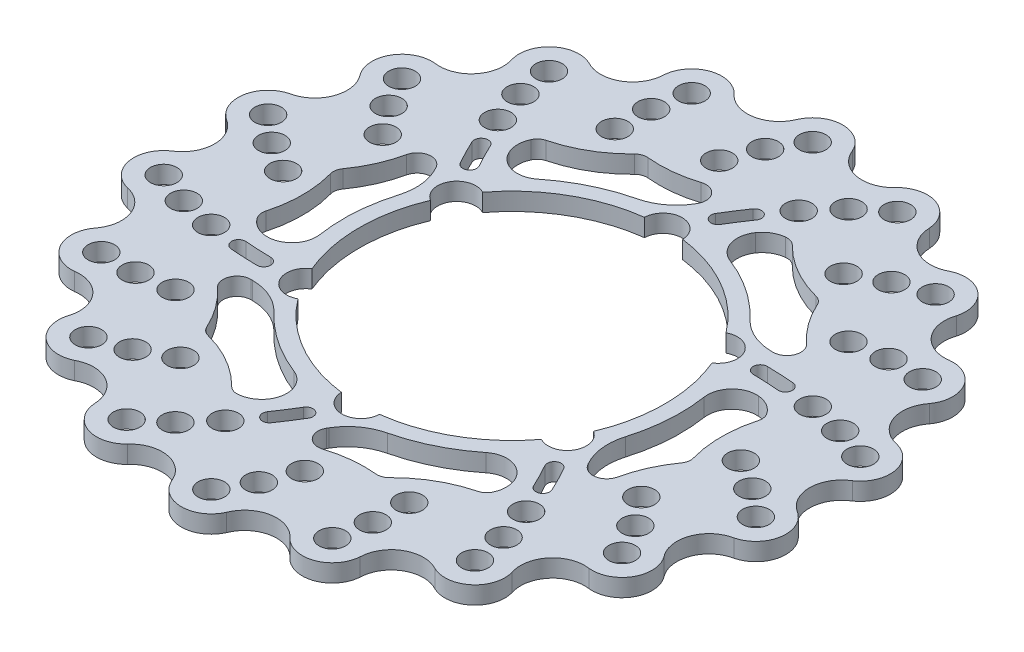
from build123d import *

# Parameters (mm, degrees)
SKETCH2_R           = 85.725
BOSS_EXTRUDE1_DEPTH = 5.08
CUT_EXTRUDE1_DEPTH  = 134.873116404
SKETCH4_R           = 3.81
CUT_EXTRUDE3_DEPTH  = 134.873116404
CUT_EXTRUDE4_DEPTH  = 10
CIRPATTERN1_DEPTH   = 5.08


# Read off the part's stored shape, not the designer's step: CirPattern1
with BuildPart() as part:
    # Sketch2 → Boss-Extrude1 (new body)
    with BuildSketch(Plane(origin=(0, 0, 0), x_dir=(1, 0, 0), z_dir=(0, 1, 0))):
        with BuildLine():
            ThreePointArc((-51.901497784, 74.123020608), (-56.734497332, 74.921995649), (-61.225519823, 72.965733207))
            ThreePointArc((-61.225519823, 72.965733207), (-63.931920113, 68.882640848), (-63.984324863, 63.984324863))
            ThreePointArc((-63.984324863, 63.984324863), (-58.164243832, 69.317446547), (-51.901497784, 74.123020608))
        make_face()
        with BuildLine():
            ThreePointArc((-51.901497784, 74.123020608), (-58.164243832, 69.317446547), (-63.984324863, 63.984324863))
            ThreePointArc((-63.984324863, 63.984324863), (-63.667616722, 59.323754786), (-65.669159886, 55.10296784))
            ThreePointArc((-65.669159886, 55.10296784), (-55.10296784, 65.669159886), (-42.8625, 74.240027739))
            ThreePointArc((-42.8625, 74.240027739), (-47.366728031, 73.001824475), (-51.901497784, 74.123020608))
        make_face()
        with BuildLine():
            ThreePointArc((-23.419888344, 87.404213206), (-27.688156797, 89.807987355), (-32.577418652, 89.50572213))
            ThreePointArc((-32.577418652, 89.50572213), (-36.517102868, 86.594513785), (-38.241669959, 82.009525879))
            ThreePointArc((-38.241669959, 82.009525879), (-30.948547719, 85.030436023), (-23.419888344, 87.404213206))
        make_face()
        with BuildLine():
            ThreePointArc((-23.419888344, 87.404213206), (-30.948547719, 85.030436023), (-38.241669959, 82.009525879))
            ThreePointArc((-38.241669959, 82.009525879), (-39.538070502, 77.521702006), (-42.8625, 74.240027739))
            ThreePointArc((-42.8625, 74.240027739), (-29.319676787, 80.555149917), (-14.88599003, 84.422644627))
            ThreePointArc((-14.88599003, 84.422644627), (-19.542070332, 84.799650873), (-23.419888344, 87.404213206))
        make_face()
        with BuildLine():
            ThreePointArc((14.88599003, 84.422644627), (10.63964946, 86.369387866), (7.886505272, 90.143167744))
            ThreePointArc((7.886505272, 90.143167744), (0, 90.4875), (-7.886505272, 90.143167744))
            ThreePointArc((-7.886505272, 90.143167744), (-10.63964946, 86.369387866), (-14.88599003, 84.422644627))
            ThreePointArc((-14.88599003, 84.422644627), (0, 85.725), (14.88599003, 84.422644627))
        make_face()
        with BuildLine():
            ThreePointArc((7.886505272, 90.143167744), (4.697784081, 93.861810361), (0, 95.25))
            ThreePointArc((0, 95.25), (-4.697784081, 93.861810361), (-7.886505272, 90.143167744))
            ThreePointArc((-7.886505272, 90.143167744), (0, 90.4875), (7.886505272, 90.143167744))
        make_face()
        with BuildLine():
            ThreePointArc((38.241669959, 82.009525879), (30.948547719, 85.030436023), (23.419888344, 87.404213206))
            ThreePointArc((23.419888344, 87.404213206), (19.542070332, 84.799650873), (14.88599003, 84.422644627))
            ThreePointArc((14.88599003, 84.422644627), (29.319676787, 80.555149917), (42.8625, 74.240027739))
            ThreePointArc((42.8625, 74.240027739), (39.538070502, 77.521702006), (38.241669959, 82.009525879))
        make_face()
        with BuildLine():
            ThreePointArc((38.241669959, 82.009525879), (36.517102868, 86.594513785), (32.577418652, 89.50572213))
            ThreePointArc((32.577418652, 89.50572213), (27.688156797, 89.807987355), (23.419888344, 87.404213206))
            ThreePointArc((23.419888344, 87.404213206), (30.948547719, 85.030436023), (38.241669959, 82.009525879))
        make_face()
        with BuildLine():
            ThreePointArc((63.984324863, 63.984324863), (63.931920113, 68.882640848), (61.225519823, 72.965733207))
            ThreePointArc((61.225519823, 72.965733207), (56.734497332, 74.921995649), (51.901497784, 74.123020608))
            ThreePointArc((51.901497784, 74.123020608), (58.164243832, 69.317446547), (63.984324863, 63.984324863))
        make_face()
        with BuildLine():
            ThreePointArc((63.984324863, 63.984324863), (58.164243832, 69.317446547), (51.901497784, 74.123020608))
            ThreePointArc((51.901497784, 74.123020608), (47.366728031, 73.001824475), (42.8625, 74.240027739))
            ThreePointArc((42.8625, 74.240027739), (55.10296784, 65.669159886), (65.669159886, 55.10296784))
            ThreePointArc((65.669159886, 55.10296784), (63.667616722, 59.323754786), (63.984324863, 63.984324863))
        make_face()
        with BuildLine():
            ThreePointArc((82.009525879, 38.241669959), (78.364473725, 45.24375), (74.123020608, 51.901497784))
            ThreePointArc((74.123020608, 51.901497784), (69.478259272, 52.398900653), (65.669159886, 55.10296784))
            ThreePointArc((65.669159886, 55.10296784), (74.240027739, 42.8625), (80.555149917, 29.319676787))
            ThreePointArc((80.555149917, 29.319676787), (80.117908731, 33.970487214), (82.009525879, 38.241669959))
        make_face()
        with BuildLine():
            ThreePointArc((82.009525879, 38.241669959), (83.635604259, 42.862504825), (82.48891971, 47.625))
            ThreePointArc((82.48891971, 47.625), (78.937820177, 50.999305536), (74.123020608, 51.901497784))
            ThreePointArc((74.123020608, 51.901497784), (78.364473725, 45.24375), (82.009525879, 38.241669959))
        make_face()
        with BuildLine():
            ThreePointArc((90.143167744, 7.886505272), (89.112791551, 15.712989477), (87.404213206, 23.419888344))
            ThreePointArc((87.404213206, 23.419888344), (83.209687054, 25.475896086), (80.555149917, 29.319676787))
            ThreePointArc((80.555149917, 29.319676787), (84.422644627, 14.88599003), (85.725, 0))
            ThreePointArc((85.725, 0), (86.904798533, 4.519877532), (90.143167744, 7.886505272))
        make_face()
        with BuildLine():
            ThreePointArc((90.143167744, 7.886505272), (93.2516002, 11.672518136), (93.802938474, 16.539988923))
            ThreePointArc((93.802938474, 16.539988923), (91.620076911, 20.925346507), (87.404213206, 23.419888344))
            ThreePointArc((87.404213206, 23.419888344), (89.112791551, 15.712989477), (90.143167744, 7.886505272))
        make_face()
        with BuildLine():
            ThreePointArc((87.404213206, -23.419888344), (89.112791551, -15.712989477), (90.143167744, -7.886505272))
            ThreePointArc((90.143167744, -7.886505272), (86.904798533, -4.519877532), (85.725, 0))
            ThreePointArc((85.725, 0), (84.422644627, -14.88599003), (80.555149917, -29.319676787))
            ThreePointArc((80.555149917, -29.319676787), (83.209687054, -25.475896086), (87.404213206, -23.419888344))
        make_face()
        with BuildLine():
            ThreePointArc((87.404213206, -23.419888344), (91.620076911, -20.925346507), (93.802938474, -16.539988923))
            ThreePointArc((93.802938474, -16.539988923), (93.2516002, -11.672518136), (90.143167744, -7.886505272))
            ThreePointArc((90.143167744, -7.886505272), (89.112791551, -15.712989477), (87.404213206, -23.419888344))
        make_face()
        with BuildLine():
            ThreePointArc((74.123020608, -51.901497784), (78.364473725, -45.24375), (82.009525879, -38.241669959))
            ThreePointArc((82.009525879, -38.241669959), (80.117908731, -33.970487214), (80.555149917, -29.319676787))
            ThreePointArc((80.555149917, -29.319676787), (74.240027739, -42.8625), (65.669159886, -55.10296784))
            ThreePointArc((65.669159886, -55.10296784), (69.478259272, -52.398900653), (74.123020608, -51.901497784))
        make_face()
        with BuildLine():
            ThreePointArc((74.123020608, -51.901497784), (78.937820177, -50.999305536), (82.48891971, -47.625))
            ThreePointArc((82.48891971, -47.625), (83.635604259, -42.862504825), (82.009525879, -38.241669959))
            ThreePointArc((82.009525879, -38.241669959), (78.364473725, -45.24375), (74.123020608, -51.901497784))
        make_face()
        with BuildLine():
            ThreePointArc((51.901497784, -74.123020608), (58.164243832, -69.317446547), (63.984324863, -63.984324863))
            ThreePointArc((63.984324863, -63.984324863), (63.667616722, -59.323754786), (65.669159886, -55.10296784))
            ThreePointArc((65.669159886, -55.10296784), (55.10296784, -65.669159886), (42.8625, -74.240027739))
            ThreePointArc((42.8625, -74.240027739), (47.366728031, -73.001824475), (51.901497784, -74.123020608))
        make_face()
        with BuildLine():
            ThreePointArc((51.901497784, -74.123020608), (56.734497332, -74.921995649), (61.225519823, -72.965733207))
            ThreePointArc((61.225519823, -72.965733207), (63.931920113, -68.882640848), (63.984324863, -63.984324863))
            ThreePointArc((63.984324863, -63.984324863), (58.164243832, -69.317446547), (51.901497784, -74.123020608))
        make_face()
        with BuildLine():
            ThreePointArc((23.419888344, -87.404213206), (30.948547719, -85.030436023), (38.241669959, -82.009525879))
            ThreePointArc((38.241669959, -82.009525879), (39.538070502, -77.521702006), (42.8625, -74.240027739))
            ThreePointArc((42.8625, -74.240027739), (29.319676787, -80.555149917), (14.88599003, -84.422644627))
            ThreePointArc((14.88599003, -84.422644627), (19.542070332, -84.799650873), (23.419888344, -87.404213206))
        make_face()
        with BuildLine():
            ThreePointArc((23.419888344, -87.404213206), (27.688156797, -89.807987355), (32.577418652, -89.50572213))
            ThreePointArc((32.577418652, -89.50572213), (36.517102868, -86.594513785), (38.241669959, -82.009525879))
            ThreePointArc((38.241669959, -82.009525879), (30.948547719, -85.030436023), (23.419888344, -87.404213206))
        make_face()
        with BuildLine():
            ThreePointArc((-7.886505272, -90.143167744), (0, -90.4875), (7.886505272, -90.143167744))
            ThreePointArc((7.886505272, -90.143167744), (10.63964946, -86.369387866), (14.88599003, -84.422644627))
            ThreePointArc((14.88599003, -84.422644627), (0, -85.725), (-14.88599003, -84.422644627))
            ThreePointArc((-14.88599003, -84.422644627), (-10.63964946, -86.369387866), (-7.886505272, -90.143167744))
        make_face()
        with BuildLine():
            ThreePointArc((-7.886505272, -90.143167744), (-4.697784081, -93.861810361), (0, -95.25))
            ThreePointArc((0, -95.25), (4.697784081, -93.861810361), (7.886505272, -90.143167744))
            ThreePointArc((7.886505272, -90.143167744), (0, -90.4875), (-7.886505272, -90.143167744))
        make_face()
        with BuildLine():
            ThreePointArc((-38.241669959, -82.009525879), (-30.948547719, -85.030436023), (-23.419888344, -87.404213206))
            ThreePointArc((-23.419888344, -87.404213206), (-19.542070332, -84.799650873), (-14.88599003, -84.422644627))
            ThreePointArc((-14.88599003, -84.422644627), (-29.319676787, -80.555149917), (-42.8625, -74.240027739))
            ThreePointArc((-42.8625, -74.240027739), (-39.538070502, -77.521702006), (-38.241669959, -82.009525879))
        make_face()
        with BuildLine():
            ThreePointArc((-38.241669959, -82.009525879), (-36.517102868, -86.594513785), (-32.577418652, -89.50572213))
            ThreePointArc((-32.577418652, -89.50572213), (-27.688156797, -89.807987355), (-23.419888344, -87.404213206))
            ThreePointArc((-23.419888344, -87.404213206), (-30.948547719, -85.030436023), (-38.241669959, -82.009525879))
        make_face()
        with BuildLine():
            ThreePointArc((-63.984324863, -63.984324863), (-58.164243832, -69.317446547), (-51.901497784, -74.123020608))
            ThreePointArc((-51.901497784, -74.123020608), (-47.366728031, -73.001824475), (-42.8625, -74.240027739))
            ThreePointArc((-42.8625, -74.240027739), (-55.10296784, -65.669159886), (-65.669159886, -55.10296784))
            ThreePointArc((-65.669159886, -55.10296784), (-63.667616722, -59.323754786), (-63.984324863, -63.984324863))
        make_face()
        with BuildLine():
            ThreePointArc((-63.984324863, -63.984324863), (-63.931920113, -68.882640848), (-61.225519823, -72.965733207))
            ThreePointArc((-61.225519823, -72.965733207), (-56.734497332, -74.921995649), (-51.901497784, -74.123020608))
            ThreePointArc((-51.901497784, -74.123020608), (-58.164243832, -69.317446547), (-63.984324863, -63.984324863))
        make_face()
        with BuildLine():
            ThreePointArc((-82.009525879, -38.241669959), (-78.364473725, -45.24375), (-74.123020608, -51.901497784))
            ThreePointArc((-74.123020608, -51.901497784), (-69.478259272, -52.398900653), (-65.669159886, -55.10296784))
            ThreePointArc((-65.669159886, -55.10296784), (-74.240027739, -42.8625), (-80.555149917, -29.319676787))
            ThreePointArc((-80.555149917, -29.319676787), (-80.117908731, -33.970487214), (-82.009525879, -38.241669959))
        make_face()
        with BuildLine():
            ThreePointArc((-82.009525879, -38.241669959), (-83.635604259, -42.862504825), (-82.48891971, -47.625))
            ThreePointArc((-82.48891971, -47.625), (-78.937820177, -50.999305536), (-74.123020608, -51.901497784))
            ThreePointArc((-74.123020608, -51.901497784), (-78.364473725, -45.24375), (-82.009525879, -38.241669959))
        make_face()
        Circle(SKETCH2_R)
        with BuildLine():
            ThreePointArc((-90.143167744, -7.886505272), (-93.2516002, -11.672518136), (-93.802938474, -16.539988923))
            ThreePointArc((-93.802938474, -16.539988923), (-91.620076911, -20.925346507), (-87.404213206, -23.419888344))
            ThreePointArc((-87.404213206, -23.419888344), (-89.112791551, -15.712989477), (-90.143167744, -7.886505272))
        make_face()
        with BuildLine():
            ThreePointArc((-87.404213206, 23.419888344), (-91.620076911, 20.925346507), (-93.802938474, 16.539988923))
            ThreePointArc((-93.802938474, 16.539988923), (-93.2516002, 11.672518136), (-90.143167744, 7.886505272))
            ThreePointArc((-90.143167744, 7.886505272), (-89.112791551, 15.712989477), (-87.404213206, 23.419888344))
        make_face()
        with BuildLine():
            ThreePointArc((-74.123020608, 51.901497784), (-78.937820177, 50.999305536), (-82.48891971, 47.625))
            ThreePointArc((-82.48891971, 47.625), (-83.635604259, 42.862504825), (-82.009525879, 38.241669959))
            ThreePointArc((-82.009525879, 38.241669959), (-78.364473725, 45.24375), (-74.123020608, 51.901497784))
        make_face()
        with BuildLine():
            ThreePointArc((-74.123020608, 51.901497784), (-78.364473725, 45.24375), (-82.009525879, 38.241669959))
            ThreePointArc((-82.009525879, 38.241669959), (-80.117908731, 33.970487214), (-80.555149917, 29.319676787))
            ThreePointArc((-80.555149917, 29.319676787), (-74.240027739, 42.8625), (-65.669159886, 55.10296784))
            ThreePointArc((-65.669159886, 55.10296784), (-69.478259272, 52.398900653), (-74.123020608, 51.901497784))
        make_face()
        with BuildLine():
            ThreePointArc((-87.404213206, 23.419888344), (-89.112791551, 15.712989477), (-90.143167744, 7.886505272))
            ThreePointArc((-90.143167744, 7.886505272), (-86.904798533, 4.519877532), (-85.725, 0))
            ThreePointArc((-85.725, 0), (-84.422644627, 14.88599003), (-80.555149917, 29.319676787))
            ThreePointArc((-80.555149917, 29.319676787), (-83.209687054, 25.475896086), (-87.404213206, 23.419888344))
        make_face()
        with BuildLine():
            ThreePointArc((-90.143167744, -7.886505272), (-89.112791551, -15.712989477), (-87.404213206, -23.419888344))
            ThreePointArc((-87.404213206, -23.419888344), (-83.209687054, -25.475896086), (-80.555149917, -29.319676787))
            ThreePointArc((-80.555149917, -29.319676787), (-84.422644627, -14.88599003), (-85.725, 0))
            ThreePointArc((-85.725, 0), (-86.904798533, -4.519877532), (-90.143167744, -7.886505272))
        make_face()
    extrude(amount=BOSS_EXTRUDE1_DEPTH)

    # Sketch3 → Cut-Extrude1 (cut, through all)
    with BuildSketch(Plane(origin=(0, 5.08, 0), x_dir=(1, 0, 0), z_dir=(0, 1, 0))):
        with BuildLine():
            ThreePointArc((-5.497810612, -43.655172414), (0, -49), (5.497810612, -43.655172414))
            ThreePointArc((5.497810612, -43.655172414), (22, -38.105117767), (35.057583011, -26.588829862))
            ThreePointArc((35.057583011, -26.588829862), (42.435244785, -24.5), (40.555393623, -17.066342552))
            ThreePointArc((40.555393623, -17.066342552), (44, 0), (40.555393623, 17.066342552))
            ThreePointArc((40.555393623, 17.066342552), (42.435244785, 24.5), (35.057583011, 26.588829862))
            ThreePointArc((35.057583011, 26.588829862), (22, 38.105117767), (5.497810612, 43.655172414))
            ThreePointArc((5.497810612, 43.655172414), (0, 49), (-5.497810612, 43.655172414))
            ThreePointArc((-5.497810612, 43.655172414), (-22, 38.105117767), (-35.057583011, 26.588829862))
            ThreePointArc((-35.057583011, 26.588829862), (-42.435244785, 24.5), (-40.555393623, 17.066342552))
            ThreePointArc((-40.555393623, 17.066342552), (-44, 0), (-40.555393623, -17.066342552))
            ThreePointArc((-40.555393623, -17.066342552), (-42.435244785, -24.5), (-35.057583011, -26.588829862))
            ThreePointArc((-35.057583011, -26.588829862), (-22, -38.105117767), (-5.497810612, -43.655172414))
        make_face()
    extrude(amount=-CUT_EXTRUDE1_DEPTH, mode=Mode.SUBTRACT)

    # Sketch4 → Cut-Extrude3 (cut, through all)
    with BuildSketch(Plane(origin=(0, 5.08, 0), x_dir=(1, 0, 0), z_dir=(0, 1, 0))):
        with Locations(Location((37.27116983, 58.247639646, 0), (0, 0, 270))):
            Circle(SKETCH4_R)
        with Locations(Location((46.242768954, 63.054604001, 0), (0, 0, 270))):
            Circle(SKETCH4_R)
        with Locations(Location((55.669906593, 66.344811182, 0), (0, 0, 270))):
            Circle(SKETCH4_R)
        with Locations(Location((75.003862255, 43.303500063, 0), (0, 0, 270))):
            Circle(SKETCH4_R)
        with Locations(Location((65.019933448, 43.435987621, 0), (0, 0, 270))):
            Circle(SKETCH4_R)
        with Locations(Location((54.945309318, 41.987386307, 0), (0, 0, 270))):
            Circle(SKETCH4_R)
        with Locations(Location((85.291245189, 15.039147745, 0), (0, 0, 270))):
            Circle(SKETCH4_R)
        with Locations(Location((75.954734377, 18.578350087, 0), (0, 0, 270))):
            Circle(SKETCH4_R)
        with Locations(Location((65.992233595, 20.662834511, 0), (0, 0, 270))):
            Circle(SKETCH4_R)
        with Locations(Location((85.291245189, -15.039147745, 0), (0, 0, 270))):
            Circle(SKETCH4_R)
        with Locations(Location((77.728273367, -8.520110655, 0), (0, 0, 270))):
            Circle(SKETCH4_R)
        with Locations(Location((69.079520559, -3.153960078, 0), (0, 0, 270))):
            Circle(SKETCH4_R)
        with Locations(Location((75.003862255, -43.303500063, 0), (0, 0, 270))):
            Circle(SKETCH4_R)
        with Locations(Location((70.126635442, -34.590920308, 0), (0, 0, 270))):
            Circle(SKETCH4_R)
        with Locations(Location((63.834797839, -26.590340534, 0), (0, 0, 270))):
            Circle(SKETCH4_R)
        with Locations(Location((55.669906593, -66.344811182, 0), (0, 0, 270))):
            Circle(SKETCH4_R)
        with Locations(Location((54.066690324, -56.489554465, 0), (0, 0, 270))):
            Circle(SKETCH4_R)
        with Locations(Location((50.890656398, -46.81953349, 0), (0, 0, 270))):
            Circle(SKETCH4_R)
        with Locations(Location((29.621338596, -81.383958927, 0), (0, 0, 270))):
            Circle(SKETCH4_R)
        with Locations(Location((31.485504413, -71.574714656, 0), (0, 0, 270))):
            Circle(SKETCH4_R)
        with Locations(Location((31.808350729, -61.401599725, 0), (0, 0, 270))):
            Circle(SKETCH4_R)
        with Locations(Location((0, -86.607000126, 0), (0, 0, 270))):
            Circle(SKETCH4_R)
        with Locations(Location((5.106701994, -78.026907929, 0), (0, 0, 270))):
            Circle(SKETCH4_R)
        with Locations(Location((8.889488521, -68.577726841, 0), (0, 0, 270))):
            Circle(SKETCH4_R)
        with Locations(Location((-29.621338596, -81.383958927, 0), (0, 0, 270))):
            Circle(SKETCH4_R)
        with Locations(Location((-21.888044053, -75.067904551, 0), (0, 0, 270))):
            Circle(SKETCH4_R)
        with Locations(Location((-15.101577197, -67.482368001, 0), (0, 0, 270))):
            Circle(SKETCH4_R)
        with Locations(Location((-55.669906593, -66.344811182, 0), (0, 0, 270))):
            Circle(SKETCH4_R)
        with Locations(Location((-46.242768954, -63.054604001, 0), (0, 0, 270))):
            Circle(SKETCH4_R)
        with Locations(Location((-37.27116983, -58.247639646, 0), (0, 0, 270))):
            Circle(SKETCH4_R)
        with Locations(Location((-75.003862255, -43.303500063, 0), (0, 0, 270))):
            Circle(SKETCH4_R)
        with Locations(Location((-65.019933448, -43.435987621, 0), (0, 0, 270))):
            Circle(SKETCH4_R)
        with Locations(Location((-54.945309318, -41.987386307, 0), (0, 0, 270))):
            Circle(SKETCH4_R)
        with Locations(Location((-85.291245189, -15.039147745, 0), (0, 0, 270))):
            Circle(SKETCH4_R)
        with Locations(Location((-75.954734377, -18.578350087, 0), (0, 0, 270))):
            Circle(SKETCH4_R)
        with Locations(Location((-65.992233595, -20.662834511, 0), (0, 0, 270))):
            Circle(SKETCH4_R)
        with Locations(Location((-85.291245189, 15.039147745, 0), (0, 0, 270))):
            Circle(SKETCH4_R)
        with Locations(Location((-77.728273367, 8.520110655, 0), (0, 0, 270))):
            Circle(SKETCH4_R)
        with Locations(Location((-69.079520559, 3.153960078, 0), (0, 0, 270))):
            Circle(SKETCH4_R)
        with Locations(Location((-75.003862255, 43.303500063, 0), (0, 0, 270))):
            Circle(SKETCH4_R)
        with Locations(Location((-70.126635442, 34.590920308, 0), (0, 0, 270))):
            Circle(SKETCH4_R)
        with Locations(Location((-63.834797839, 26.590340534, 0), (0, 0, 270))):
            Circle(SKETCH4_R)
        with Locations(Location((-55.669906593, 66.344811182, 0), (0, 0, 270))):
            Circle(SKETCH4_R)
        with Locations(Location((-54.066690324, 56.489554465, 0), (0, 0, 270))):
            Circle(SKETCH4_R)
        with Locations(Location((-50.890656398, 46.81953349, 0), (0, 0, 270))):
            Circle(SKETCH4_R)
        with Locations(Location((-29.621338596, 81.383958927, 0), (0, 0, 270))):
            Circle(SKETCH4_R)
        with Locations(Location((-31.485504413, 71.574714656, 0), (0, 0, 270))):
            Circle(SKETCH4_R)
        with Locations(Location((-31.808350729, 61.401599725, 0), (0, 0, 270))):
            Circle(SKETCH4_R)
        with Locations(Location((0, 86.607000126, 0), (0, 0, 270))):
            Circle(SKETCH4_R)
        with Locations(Location((-5.106701994, 78.026907929, 0), (0, 0, 270))):
            Circle(SKETCH4_R)
        with Locations(Location((-8.889488521, 68.577726841, 0), (0, 0, 270))):
            Circle(SKETCH4_R)
        with Locations(Location((29.621338596, 81.383958927, 0), (0, 0, 270))):
            Circle(SKETCH4_R)
        with Locations(Location((21.888044053, 75.067904551, 0), (0, 0, 270))):
            Circle(SKETCH4_R)
        with Locations(Location((15.101577197, 67.482368001, 0), (0, 0, 270))):
            Circle(SKETCH4_R)
    extrude(amount=-CUT_EXTRUDE3_DEPTH, mode=Mode.SUBTRACT)

    # Sketch7 → Cut-Extrude4 (cut)
    with BuildSketch(Plane(origin=(0, 5.08, 0), x_dir=(1, 0, 0), z_dir=(0, 1, 0))):
        with BuildLine():
            ThreePointArc((3.791667044, 54.854998188), (4.479540288, 52.111491235), (7.22304724, 52.799364479))
            add(Edge.make_bspline(
                [(11.281073188, 59.091849632), (10.749041455, 58.324094499), (9.709773322, 56.76981137), (8.695264953, 55.196690457), (7.705537011, 53.604763728), (7.22304724, 52.799364479)],
                knots=[0.500790485, 0.500790485, 0.500790485, 0.550288491, 0.599786496, 0.649284502, 0.698782508, 0.698782508, 0.698782508], degree=2))
            ThreePointArc((11.281073188, 59.091849632), (10.776355466, 61.874880358), (7.99332474, 61.370162636))
            add(Edge.make_bspline(
                [(7.99332474, 61.370162636), (7.442345587, 60.575065189), (6.366142379, 58.965539536), (5.315729837, 57.336748049), (4.291087298, 55.688658758), (3.791667044, 54.854998188)],
                knots=[0.500790485, 0.500790485, 0.500790485, 0.550288491, 0.599786496, 0.649284502, 0.698782508, 0.698782508, 0.698782508], degree=2))
        make_face()
        with BuildLine():
            ThreePointArc((14.292450935, 55.792149006), (13.387874277, 49.708348422), (17.583632926, 45.210960531))
            ThreePointArc((17.583632926, 45.210960531), (27.068562434, 40.255534113), (35.236189701, 33.341056288))
            ThreePointArc((35.236189701, 33.341056288), (40.248891101, 29.811516654), (46.23916721, 28.507132702))
            add(Edge.make_bspline(
                [(46.719267762, 28.506776323), (46.479384418, 28.507583123), (46.23916721, 28.507132702)],
                knots=[0.863828909, 0.863828909, 0.863828909, 0.872894813, 0.872894813, 0.872894813], degree=2))
            ThreePointArc((46.719267762, 28.506776323), (50.427987195, 31.071988556), (49.391241104, 35.460618316))
            ThreePointArc((49.391241104, 35.460618316), (44.725632746, 40.677873724), (41.203752637, 46.726345914))
            ThreePointArc((41.203752637, 46.726345914), (40.255764406, 47.974951854), (38.861511167, 48.691719867))
            ThreePointArc((38.861511167, 48.691719867), (30.159417963, 52.244762109), (22.73252992, 58.00600063))
            ThreePointArc((22.73252992, 58.00600063), (21.379355934, 58.868055367), (19.784620024, 59.044224545))
            ThreePointArc((19.784620024, 59.044224545), (16.675417538, 58.031427492), (14.292450935, 55.792149006))
        make_face()
    extrude(amount=-CUT_EXTRUDE4_DEPTH, mode=Mode.SUBTRACT)

    # CirPattern1 outline → CirPattern1 (cut)
    with BuildSketch(Plane(origin=(0, 0, 0), x_dir=(1, 0, 0), z_dir=(0, 1, 0))):
        with BuildLine():
            add(Edge.make_bspline(
                [(-1.327958595, 54.71346089), (-1.448598976, 54.506119219), (-1.568317504, 54.297859804)],
                knots=[0.863828909, 0.863828909, 0.863828909, 0.872894813, 0.872894813, 0.872894813], degree=2))
            ThreePointArc((-1.327958595, 54.71346089), (-1.695137838, 59.207912251), (-6.014175744, 60.504378678))
            ThreePointArc((-6.014175744, 60.504378678), (-12.865255644, 59.072471021), (-19.864326269, 59.046669471))
            ThreePointArc((-19.864326269, 59.046669471), (-21.419644848, 58.849990551), (-22.737510775, 58.000915834))
            ThreePointArc((-22.737510775, 58.000915834), (-30.16558222, 52.241203174), (-38.868405158, 48.689948718))
            ThreePointArc((-38.868405158, 48.689948718), (-40.291553452, 47.949093039), (-41.24148839, 46.656095817))
            ThreePointArc((-41.24148839, 46.656095817), (-41.918981657, 43.457048952), (-41.171192903, 40.273700095))
            ThreePointArc((-41.171192903, 40.273700095), (-36.354755375, 36.448413437), (-30.362023887, 37.83335307))
            ThreePointArc((-30.362023887, 37.83335307), (-21.328033968, 43.569829769), (-11.256106884, 47.185963557))
            ThreePointArc((-11.256106884, 47.185963557), (-5.693085198, 49.762320495), (-1.568317504, 54.297859804))
        make_face()
        with BuildLine():
            add(Edge.make_bspline(
                [(56.815579532, 19.776228854), (55.884668216, 19.853104283), (54.018985475, 19.975995323), (52.149368617, 20.068024887), (50.275855658, 20.129191062), (49.337114563, 20.144339837)],
                knots=[0.500790485, 0.500790485, 0.500790485, 0.550288491, 0.599786496, 0.649284502, 0.698782508, 0.698782508, 0.698782508], degree=2))
            ThreePointArc((56.815579532, 19.776228854), (58.973395979, 21.604842586), (57.144782247, 23.762659033))
            add(Edge.make_bspline(
                [(57.144782247, 23.762659033), (56.180718083, 23.842272252), (54.248726376, 23.969528744), (52.312945299, 24.064816946), (50.373336836, 24.128138769), (49.401655477, 24.143819112)],
                knots=[0.500790485, 0.500790485, 0.500790485, 0.550288491, 0.599786496, 0.649284502, 0.698782508, 0.698782508, 0.698782508], degree=2))
            ThreePointArc((49.401655477, 24.143819112), (47.369645383, 22.176349931), (49.337114563, 20.144339837))
        make_face()
        with BuildLine():
            add(Edge.make_bspline(
                [(-11.281073188, -59.091849632), (-10.749041455, -58.324094499), (-9.709773322, -56.76981137), (-8.695264953, -55.196690457), (-7.705537011, -53.604763728), (-7.22304724, -52.799364479)],
                knots=[0.500790485, 0.500790485, 0.500790485, 0.550288491, 0.599786496, 0.649284502, 0.698782508, 0.698782508, 0.698782508], degree=2))
            ThreePointArc((-11.281073188, -59.091849632), (-10.776355466, -61.874880358), (-7.99332474, -61.370162636))
            add(Edge.make_bspline(
                [(-7.99332474, -61.370162636), (-7.442345587, -60.575065189), (-6.366142379, -58.965539536), (-5.315729837, -57.336748049), (-4.291087298, -55.688658758), (-3.791667044, -54.854998188)],
                knots=[0.500790485, 0.500790485, 0.500790485, 0.550288491, 0.599786496, 0.649284502, 0.698782508, 0.698782508, 0.698782508], degree=2))
            ThreePointArc((-3.791667044, -54.854998188), (-4.479540287, -52.111491235), (-7.22304724, -52.799364479))
        make_face()
        with BuildLine():
            add(Edge.make_bspline(
                [(1.327958595, -54.71346089), (1.448598976, -54.506119219), (1.568317504, -54.297859804)],
                knots=[0.863828909, 0.863828909, 0.863828909, 0.872894813, 0.872894813, 0.872894813], degree=2))
            ThreePointArc((1.327958595, -54.71346089), (1.695137838, -59.207912251), (6.014175744, -60.504378678))
            ThreePointArc((6.014175744, -60.504378678), (12.865255644, -59.072471021), (19.864326269, -59.046669471))
            ThreePointArc((19.864326269, -59.046669471), (21.419644848, -58.849990551), (22.737510775, -58.000915834))
            ThreePointArc((22.737510775, -58.000915834), (30.16558222, -52.241203174), (38.868405158, -48.689948718))
            ThreePointArc((38.868405158, -48.689948718), (40.291553452, -47.949093039), (41.24148839, -46.656095817))
            ThreePointArc((41.24148839, -46.656095817), (41.918981657, -43.457048952), (41.171192903, -40.273700095))
            ThreePointArc((41.171192903, -40.273700095), (36.354755375, -36.448413437), (30.362023887, -37.83335307))
            ThreePointArc((30.362023887, -37.83335307), (21.328033968, -43.569829769), (11.256106884, -47.185963557))
            ThreePointArc((11.256106884, -47.185963557), (5.693085198, -49.762320495), (1.568317504, -54.297859804))
        make_face()
        with BuildLine():
            add(Edge.make_bspline(
                [(45.534506344, -39.315620779), (45.135626761, -38.470990215), (44.309212153, -36.793816047), (43.454103664, -35.12866557), (42.570318647, -33.475572666), (42.114067323, -32.655024643)],
                knots=[0.500790485, 0.500790485, 0.500790485, 0.550288491, 0.599786496, 0.649284502, 0.698782508, 0.698782508, 0.698782508], degree=2))
            ThreePointArc((45.534506344, -39.315620779), (48.197040514, -40.270037773), (49.151457507, -37.607503603))
            add(Edge.make_bspline(
                [(49.151457507, -37.607503603), (48.738372496, -36.732792937), (47.882583997, -34.996010792), (46.997215462, -33.271931103), (46.082249539, -31.560519989), (45.609988434, -30.711179077)],
                knots=[0.500790485, 0.500790485, 0.500790485, 0.550288491, 0.599786496, 0.649284502, 0.698782508, 0.698782508, 0.698782508], degree=2))
            ThreePointArc((45.609988434, -30.711179077), (42.890105095, -29.935141304), (42.114067323, -32.655024643))
        make_face()
        with BuildLine():
            add(Edge.make_bspline(
                [(48.047226357, -26.206684566), (47.927983394, -25.998536097), (47.807484714, -25.790727102)],
                knots=[0.863828909, 0.863828909, 0.863828909, 0.872894813, 0.872894813, 0.872894813], degree=2))
            ThreePointArc((48.047226357, -26.206684566), (52.123125033, -28.135923695), (55.405416848, -25.043760362))
            ThreePointArc((55.405416848, -25.043760362), (57.59088839, -18.394597296), (61.068078906, -12.320323558))
            ThreePointArc((61.068078906, -12.320323558), (61.675409254, -10.875038698), (61.599021942, -9.309195967))
            ThreePointArc((61.599021942, -9.309195967), (60.325000183, 0.003558935), (61.600935078, 9.316051913))
            ThreePointArc((61.600935078, 9.316051913), (61.670909387, 10.918962328), (61.026108414, 12.388128727))
            ThreePointArc((61.026108414, 12.388128727), (58.594399195, 14.574378539), (55.463643838, 15.518448911))
            ThreePointArc((55.463643838, 15.518448911), (49.742629651, 13.259934984), (47.945656812, 7.377607461))
            ThreePointArc((47.945656812, 7.377607461), (48.396596402, -3.314295655), (46.492296585, -13.844907269))
            ThreePointArc((46.492296585, -13.844907269), (45.941976299, -19.95080384), (47.807484714, -25.790727102))
        make_face()
        with BuildLine():
            add(Edge.make_bspline(
                [(-46.719267762, -28.506776323), (-46.479384418, -28.507583123), (-46.23916721, -28.507132702)],
                knots=[0.863828909, 0.863828909, 0.863828909, 0.872894813, 0.872894813, 0.872894813], degree=2))
            ThreePointArc((-46.719267762, -28.506776323), (-50.427987195, -31.071988556), (-49.391241104, -35.460618316))
            ThreePointArc((-49.391241104, -35.460618316), (-44.725632746, -40.677873724), (-41.203752637, -46.726345914))
            ThreePointArc((-41.203752637, -46.726345914), (-40.255764406, -47.974951854), (-38.861511167, -48.691719867))
            ThreePointArc((-38.861511167, -48.691719867), (-30.159417963, -52.244762109), (-22.73252992, -58.00600063))
            ThreePointArc((-22.73252992, -58.00600063), (-21.379355935, -58.868055367), (-19.784620024, -59.044224545))
            ThreePointArc((-19.784620024, -59.044224545), (-16.675417538, -58.031427492), (-14.292450935, -55.792149006))
            ThreePointArc((-14.292450935, -55.792149006), (-13.387874277, -49.708348422), (-17.583632926, -45.210960531))
            ThreePointArc((-17.583632926, -45.210960531), (-27.068562434, -40.255534113), (-35.236189701, -33.341056288))
            ThreePointArc((-35.236189701, -33.341056288), (-40.248891101, -29.811516654), (-46.23916721, -28.507132702))
        make_face()
        with BuildLine():
            add(Edge.make_bspline(
                [(-56.815579532, -19.776228854), (-55.884668216, -19.853104283), (-54.018985475, -19.975995323), (-52.149368617, -20.068024887), (-50.275855658, -20.129191062), (-49.337114563, -20.144339837)],
                knots=[0.500790485, 0.500790485, 0.500790485, 0.550288491, 0.599786496, 0.649284502, 0.698782508, 0.698782508, 0.698782508], degree=2))
            ThreePointArc((-56.815579532, -19.776228854), (-58.973395979, -21.604842586), (-57.144782247, -23.762659033))
            add(Edge.make_bspline(
                [(-57.144782247, -23.762659033), (-56.180718083, -23.842272252), (-54.248726376, -23.969528744), (-52.312945299, -24.064816946), (-50.373336836, -24.128138769), (-49.401655477, -24.143819112)],
                knots=[0.500790485, 0.500790485, 0.500790485, 0.550288491, 0.599786496, 0.649284502, 0.698782508, 0.698782508, 0.698782508], degree=2))
            ThreePointArc((-49.401655477, -24.143819112), (-47.369645383, -22.176349931), (-49.337114563, -20.144339837))
        make_face()
        with BuildLine():
            add(Edge.make_bspline(
                [(-48.047226357, 26.206684566), (-47.927983394, 25.998536097), (-47.807484714, 25.790727102)],
                knots=[0.863828909, 0.863828909, 0.863828909, 0.872894813, 0.872894813, 0.872894813], degree=2))
            ThreePointArc((-48.047226357, 26.206684566), (-52.123125033, 28.135923695), (-55.405416848, 25.043760362))
            ThreePointArc((-55.405416848, 25.043760362), (-57.59088839, 18.394597296), (-61.068078906, 12.320323558))
            ThreePointArc((-61.068078906, 12.320323558), (-61.675409254, 10.875038698), (-61.599021942, 9.309195967))
            ThreePointArc((-61.599021942, 9.309195967), (-60.325000183, -0.003558935), (-61.600935078, -9.316051913))
            ThreePointArc((-61.600935078, -9.316051913), (-61.670909387, -10.918962328), (-61.026108414, -12.388128727))
            ThreePointArc((-61.026108414, -12.388128727), (-58.594399195, -14.574378539), (-55.463643838, -15.518448911))
            ThreePointArc((-55.463643838, -15.518448911), (-49.742629651, -13.259934984), (-47.945656812, -7.377607461))
            ThreePointArc((-47.945656812, -7.377607461), (-48.396596402, 3.314295655), (-46.492296585, 13.844907269))
            ThreePointArc((-46.492296585, 13.844907269), (-45.941976299, 19.95080384), (-47.807484714, 25.790727102))
        make_face()
        with BuildLine():
            add(Edge.make_bspline(
                [(-45.534506344, 39.315620779), (-45.135626761, 38.470990215), (-44.309212153, 36.793816047), (-43.454103664, 35.12866557), (-42.570318647, 33.475572666), (-42.114067323, 32.655024643)],
                knots=[0.500790485, 0.500790485, 0.500790485, 0.550288491, 0.599786496, 0.649284502, 0.698782508, 0.698782508, 0.698782508], degree=2))
            ThreePointArc((-45.534506344, 39.315620779), (-48.197040514, 40.270037773), (-49.151457507, 37.607503603))
            add(Edge.make_bspline(
                [(-49.151457507, 37.607503603), (-48.738372496, 36.732792937), (-47.882583997, 34.996010792), (-46.997215462, 33.271931103), (-46.082249539, 31.560519989), (-45.609988434, 30.711179077)],
                knots=[0.500790485, 0.500790485, 0.500790485, 0.550288491, 0.599786496, 0.649284502, 0.698782508, 0.698782508, 0.698782508], degree=2))
            ThreePointArc((-45.609988434, 30.711179077), (-42.890105095, 29.935141304), (-42.114067323, 32.655024643))
        make_face()
    extrude(amount=CIRPATTERN1_DEPTH, mode=Mode.SUBTRACT)


solid = part.part
